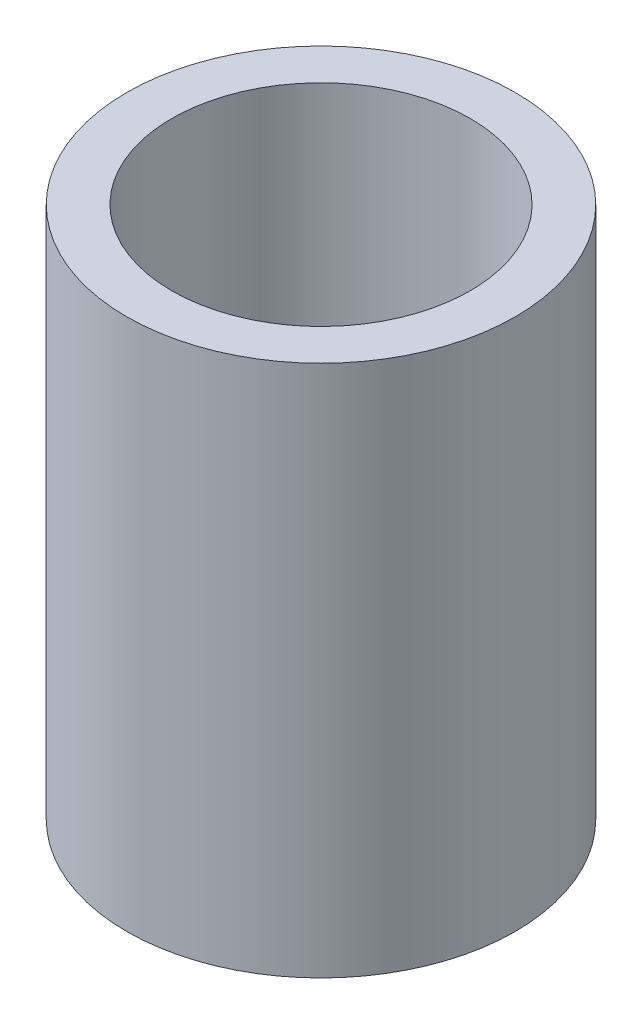
from build123d import *

# Parameters (mm, degrees)
SKETCH1_R           = 20
BOSS_EXTRUDE1_DEPTH = 54.805818981
SKETCH2_R           = 15.364386492
CUT_EXTRUDE1_DEPTH  = 62.673963665


with BuildPart() as part:
    # Sketch1 → Boss-Extrude1 (new body)
    with BuildSketch(Plane(origin=(0, 0, 0), x_dir=(1, 0, 0), z_dir=(0, 1, 0))):
        Circle(SKETCH1_R)
    extrude(amount=BOSS_EXTRUDE1_DEPTH)

    # Sketch2 → Cut-Extrude1 (cut, through all)
    with BuildSketch(Plane(origin=(0, 0, 0), x_dir=(1, 0, 0), z_dir=(0, 1, 0))):
        Circle(SKETCH2_R)
    extrude(amount=CUT_EXTRUDE1_DEPTH, mode=Mode.SUBTRACT)


solid = part.part
